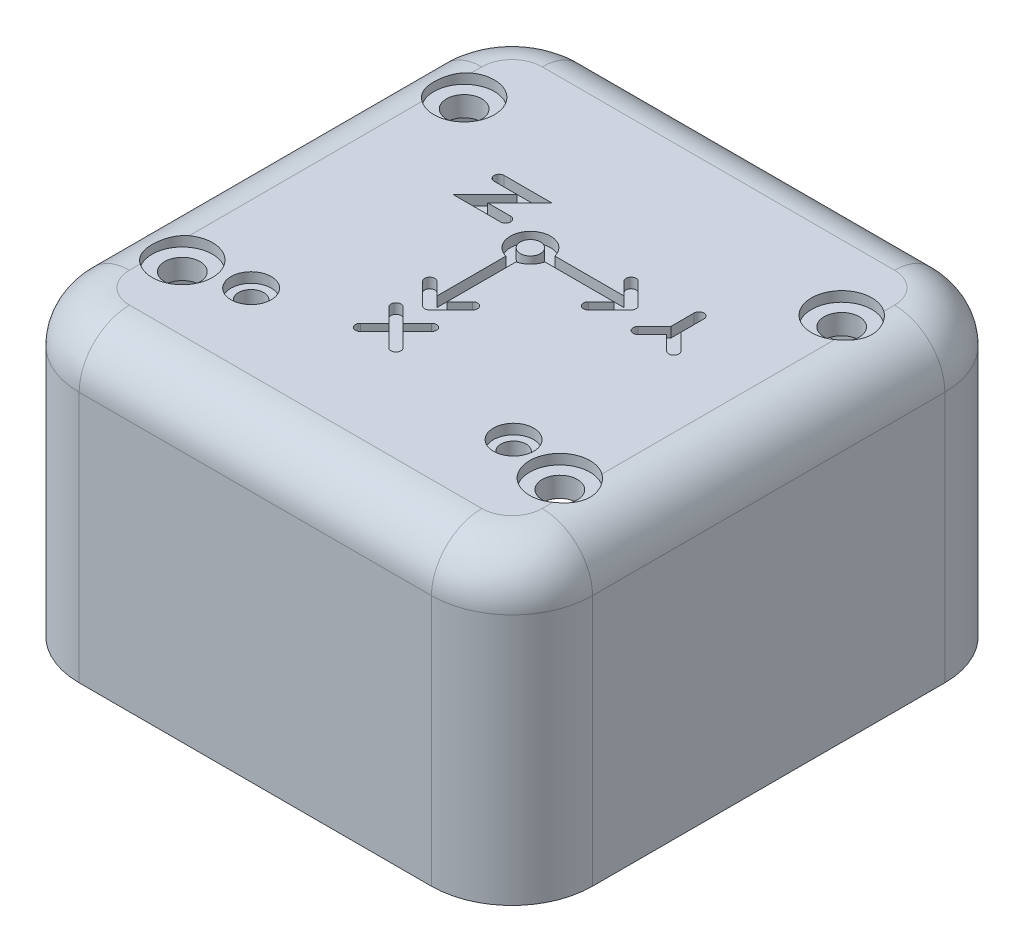
from build123d import *

# Parameters (mm, degrees)
BOSS_EXTRUDE1_DEPTH = 30
CUT_EXTRUDE1_DEPTH  = 27
SKETCH3_R           = 1.75
SKETCH3_R_2         = 1.25
CUT_EXTRUDE2_DEPTH  = 3
SKETCH4_R           = 3
SKETCH4_R_2         = 2
CUT_EXTRUDE3_DEPTH  = 1
CUT_EXTRUDE4_DEPTH  = 2
FILLET1_R           = 5
FILLET2_R           = 1.5
SKETCH6_R           = 1
CUT_EXTRUDE5_DEPTH  = 1
CUT_EXTRUDE6_DEPTH  = 0.8


with BuildPart() as part:
    # Sketch1 → Boss-Extrude1 (new body)
    with BuildSketch(Plane(origin=(0, 0, 0), x_dir=(1, 0, 0), z_dir=(0, 1, 0))):
        with BuildLine():
            Line((8, 0), (43, 0))
            ThreePointArc((43, 0), (48.656854249, 2.343145751), (51, 8))
            Line((51, 8), (51, 43))
            ThreePointArc((51, 43), (48.656854249, 48.656854249), (43, 51))
            Line((43, 51), (8, 51))
            ThreePointArc((8, 51), (2.343145751, 48.656854249), (0, 43))
            Line((0, 43), (0, 8))
            ThreePointArc((0, 8), (2.343145751, 2.343145751), (8, 0))
        make_face()
    extrude(amount=BOSS_EXTRUDE1_DEPTH)

    # Sketch2 → Cut-Extrude1 (cut)
    with BuildSketch(Plane.XZ):
        with BuildLine():
            Line((8, -2), (43, -2))
            ThreePointArc((43, -2), (47.242640687, -3.757359313), (49, -8))
            Line((49, -8), (49, -43))
            ThreePointArc((49, -43), (47.242640687, -47.242640687), (43, -49))
            Line((43, -49), (8, -49))
            ThreePointArc((8, -49), (3.757359313, -47.242640687), (2, -43))
            Line((2, -43), (2, -8))
            ThreePointArc((2, -8), (3.757359313, -3.757359313), (8, -2))
        make_face()
    extrude(amount=-CUT_EXTRUDE1_DEPTH, mode=Mode.SUBTRACT)

    # Sketch3 → Cut-Extrude2 (cut)
    with BuildSketch(Plane.XZ.offset(-27)):
        with Locations(Location((6.75, -11.5, 0), (0, 0, 270))):
            Circle(SKETCH3_R)
        with Locations(Location((44.25, -11.5, 0), (0, 0, 90))):
            Circle(SKETCH3_R)
        with Locations(Location((44.25, -39.5, 0), (0, 0, 270))):
            Circle(SKETCH3_R)
        with Locations(Location((6.75, -39.5, 0), (0, 0, 90))):
            Circle(SKETCH3_R)
        with Locations(Location((38.655, -12.5, 0), (0, 0, 270))):
            Circle(SKETCH3_R_2)
        with Locations(Location((12.585, -12.5, 0), (0, 0, 270))):
            Circle(SKETCH3_R_2)
    extrude(amount=-CUT_EXTRUDE2_DEPTH, mode=Mode.SUBTRACT)

    # Sketch4 → Cut-Extrude3 (cut)
    with BuildSketch(Plane(origin=(0, 30, 0), x_dir=(1, 0, 0), z_dir=(0, 1, 0))):
        with Locations(Location((44.25, 39.5, 0), (0, 0, 270))):
            Circle(SKETCH4_R)
        with Locations(Location((6.75, 39.5, 0), (0, 0, 270))):
            Circle(SKETCH4_R)
        with Locations(Location((6.75, 11.5, 0), (0, 0, 270))):
            Circle(SKETCH4_R)
        with Locations(Location((12.585, 12.5, 0), (0, 0, 270))):
            Circle(SKETCH4_R_2)
        with Locations(Location((38.655, 12.5, 0), (0, 0, 270))):
            Circle(SKETCH4_R_2)
        with Locations(Location((44.25, 11.5, 0), (0, 0, 270))):
            Circle(SKETCH4_R)
    extrude(amount=-CUT_EXTRUDE3_DEPTH, mode=Mode.SUBTRACT)

    # Sketch5 → Cut-Extrude4 (cut)
    with BuildSketch(Plane.XY.offset(-49)):
        with BuildLine():
            Line((9.585, 18), (34.085, 18))
            ThreePointArc((34.085, 18), (34.792106781, 17.707106781), (35.085, 17))
            Line((35.085, 17), (35.085, 14))
            ThreePointArc((35.085, 14), (34.792106781, 13.292893219), (34.085, 13))
            Line((34.085, 13), (9.585, 13))
            ThreePointArc((9.585, 13), (8.877893219, 13.292893219), (8.585, 14))
            Line((8.585, 14), (8.585, 17))
            ThreePointArc((8.585, 17), (8.877893219, 17.707106781), (9.585, 18))
        make_face()
    extrude(amount=-CUT_EXTRUDE4_DEPTH, mode=Mode.SUBTRACT)

    # Fillet1
    # the kernel refuses this fillet: 5 mm, written as the material it takes off along each edge
    with BuildSketch(Plane(origin=(8, 30, -43), x_dir=(0, 0, -1), z_dir=(1, 0, 0))) as fillet1_piece_1:
        with BuildLine():
            CenterArc((8 - FILLET1_R, -FILLET1_R), FILLET1_R, 0, 90)
            Line((8 - FILLET1_R, 0), (8, 0))
            Line((8, 0), (8, -FILLET1_R))
        make_face()
    revolve(axis=Axis((8, 30, -43), (0, 1, 0)), revolution_arc=90, mode=Mode.SUBTRACT)
    with BuildSketch(Plane(origin=(0, 30, -43), x_dir=(0, -1, 0), z_dir=(0, 0, 1))) as fillet1_piece_2:
        with BuildLine():
            CenterArc((FILLET1_R, FILLET1_R), FILLET1_R, 180, 90)
            Line((0, FILLET1_R), (0, 0))
            Line((0, 0), (FILLET1_R, 0))
        make_face()
    extrude(amount=35, mode=Mode.SUBTRACT)
    with BuildSketch(Plane(origin=(8, 30, -8), x_dir=(-1, 0, 0), z_dir=(0, 0, -1))) as fillet1_piece_3:
        with BuildLine():
            CenterArc((8 - FILLET1_R, -FILLET1_R), FILLET1_R, 0, 90)
            Line((8 - FILLET1_R, 0), (8, 0))
            Line((8, 0), (8, -FILLET1_R))
        make_face()
    revolve(axis=Axis((8, 30, -8), (0, 1, 0)), revolution_arc=90, mode=Mode.SUBTRACT)
    with BuildSketch(Plane(origin=(8, 30, 0), x_dir=(0, 0, -1), z_dir=(1, 0, 0)), Plane(origin=(51, 30, -8), x_dir=(-1, 0, 0), z_dir=(0, 0, -1)), Plane(origin=(43, 30, -51), x_dir=(0, 0, 1), z_dir=(-1, 0, 0))) as fillet1_piece_4:
        with BuildLine():
            CenterArc((FILLET1_R, -FILLET1_R), FILLET1_R, 90, 90)
            Line((0, -FILLET1_R), (0, 0))
            Line((0, 0), (FILLET1_R, 0))
        make_face()
    extrude(amount=35, mode=Mode.SUBTRACT)
    with BuildSketch(Plane(origin=(43, 30, -8), x_dir=(0, 0, 1), z_dir=(-1, 0, 0))) as fillet1_piece_5:
        with BuildLine():
            CenterArc((8 - FILLET1_R, -FILLET1_R), FILLET1_R, 0, 90)
            Line((8, -FILLET1_R), (8, 0))
            Line((8, 0), (8 - FILLET1_R, 0))
        make_face()
    revolve(axis=Axis((43, 30, -8), (0, 1, 0)), revolution_arc=90, mode=Mode.SUBTRACT)
    with BuildSketch(Plane(origin=(43, 30, -43), x_dir=(1, 0, 0), z_dir=(0, 0, 1))) as fillet1_piece_6:
        with BuildLine():
            CenterArc((8 - FILLET1_R, -FILLET1_R), FILLET1_R, 0, 90)
            Line((8, -FILLET1_R), (8, 0))
            Line((8, 0), (8 - FILLET1_R, 0))
        make_face()
    revolve(axis=Axis((43, 30, -43), (0, 1, 0)), revolution_arc=90, mode=Mode.SUBTRACT)

    # Fillet2
    fillet2_edges = [part.edges().sort_by_distance(p)[0] for p in [
        (47.242640687, 27, -47.242640687),
        (25.5, 27, -49),
        (3.757359313, 27, -47.242640687),
        (2, 27, -25.5),
        (3.757359313, 27, -3.757359313),
        (25.5, 27, -2),
        (47.242640687, 27, -3.757359313),
        (49, 27, -25.5),
    ]]
    fillet(fillet2_edges, radius=FILLET2_R)

    # Sketch6 → Cut-Extrude5 (cut)
    # profile 1 of 4: a face of its own
    with BuildSketch(Plane(origin=(0, 30, 0), x_dir=(1, 0, 0), z_dir=(0, 1, 0))):
        with BuildLine():
            Line((24.920410097, 30.348440054), (31.776811643, 30.348440054))
            Line((31.776811643, 30.348440054), (30.50904469, 31.616207007))
            ThreePointArc((30.50904469, 31.616207007), (30.50904469, 32.323313788), (31.216151471, 32.323313788))
            Line((31.216151471, 32.323313788), (33.337471815, 30.201993444))
            ThreePointArc((33.337471815, 30.201993444), (33.483918424, 29.848440054), (33.337471815, 29.494886663))
            Line((33.337471815, 29.494886663), (31.216151471, 27.37356632))
            ThreePointArc((31.216151471, 27.37356632), (30.50904469, 27.37356632), (30.50904469, 28.080673101))
            Line((30.50904469, 28.080673101), (31.776811643, 29.348440054))
            Line((31.776811643, 29.348440054), (24.920410097, 29.348440054))
            ThreePointArc((24.920410097, 29.348440054), (24.398131986, 28.434226491), (23.483918424, 27.911948381))
            Line((23.483918424, 27.911948381), (23.483918424, 21.055546835))
            Line((23.483918424, 21.055546835), (24.751685377, 22.323313788))
            ThreePointArc((24.751685377, 22.323313788), (25.458792158, 22.323313788), (25.458792158, 21.616207007))
            Line((25.458792158, 21.616207007), (23.337471815, 19.494886663))
            ThreePointArc((23.337471815, 19.494886663), (22.983918424, 19.348440054), (22.630365033, 19.494886663))
            Line((22.630365033, 19.494886663), (20.50904469, 21.616207007))
            ThreePointArc((20.50904469, 21.616207007), (20.50904469, 22.323313788), (21.216151471, 22.323313788))
            Line((21.216151471, 22.323313788), (22.483918424, 21.055546835))
            Line((22.483918424, 21.055546835), (22.483918424, 27.911948381))
            ThreePointArc((22.483918424, 27.911948381), (21.569704862, 31.262653616), (24.920410097, 30.348440054))
        make_face()
        with Locations(Location((22.983918424, 29.848440054, 0), (0, 0, 270))):
            Circle(SKETCH6_R, mode=Mode.SUBTRACT)
    # profile 2 of 4: a face of its own
    with BuildSketch(Plane(origin=(0, 30, 0), x_dir=(1, 0, 0), z_dir=(0, 1, 0))):
        with BuildLine():
            Line((20.166103424, 34.766202804), (15.455317355, 34.766202804))
            ThreePointArc((15.455317355, 34.766202804), (14.955317355, 34.266202804), (15.455317355, 33.766202804))
            Line((15.455317355, 33.766202804), (17.751889862, 33.766202804))
            Line((17.751889862, 33.766202804), (14.569909347, 30.584222289))
            Line((14.569909347, 30.584222289), (19.277016128, 30.584222289))
            ThreePointArc((19.277016128, 30.584222289), (19.777016128, 31.084222289), (19.277016128, 31.584222289))
            Line((19.277016128, 31.584222289), (16.984122909, 31.584222289))
            Line((16.984122909, 31.584222289), (20.166103424, 34.766202804))
        make_face()
    # profile 3 of 4: a face of its own
    with BuildSketch(Plane(origin=(0, 30, 0), x_dir=(1, 0, 0), z_dir=(0, 1, 0))):
        with BuildLine():
            Line((37.725215013, 30.056361033), (37.725215013, 32.349254251))
            ThreePointArc((37.725215013, 32.349254251), (37.225215013, 32.849254251), (36.725215013, 32.349254251))
            Line((36.725215013, 32.349254251), (36.725215013, 30.056361033))
            Line((36.725215013, 30.056361033), (35.103894669, 28.435040689))
            ThreePointArc((35.103894669, 28.435040689), (35.103894669, 27.727933908), (35.81100145, 27.727933908))
            Line((35.81100145, 27.727933908), (37.225215013, 29.14214747))
            Line((37.225215013, 29.14214747), (38.639428575, 27.727933908))
            ThreePointArc((38.639428575, 27.727933908), (39.346535356, 27.727933908), (39.346535356, 28.435040689))
            Line((39.346535356, 28.435040689), (37.725215013, 30.056361033))
        make_face()
    # profile 4 of 4: a face of its own
    with BuildSketch(Plane(origin=(0, 30, 0), x_dir=(1, 0, 0), z_dir=(0, 1, 0))):
        with BuildLine():
            Line((23.864017642, 16.318192841), (25.278231204, 17.732406403))
            ThreePointArc((25.278231204, 17.732406403), (25.278231204, 18.439513185), (24.571124423, 18.439513185))
            Line((24.571124423, 18.439513185), (23.15691086, 17.025299622))
            Line((23.15691086, 17.025299622), (21.742697298, 18.439513185))
            ThreePointArc((21.742697298, 18.439513185), (21.035590517, 18.439513185), (21.035590517, 17.732406403))
            Line((21.035590517, 17.732406403), (22.449804079, 16.318192841))
            Line((22.449804079, 16.318192841), (21.035590517, 14.903979279))
            ThreePointArc((21.035590517, 14.903979279), (21.035590517, 14.196872497), (21.742697298, 14.196872497))
            Line((21.742697298, 14.196872497), (23.15691086, 15.61108606))
            Line((23.15691086, 15.61108606), (24.571124423, 14.196872497))
            ThreePointArc((24.571124423, 14.196872497), (25.278231204, 14.196872497), (25.278231204, 14.903979279))
            Line((25.278231204, 14.903979279), (23.864017642, 16.318192841))
        make_face()
    extrude(amount=-CUT_EXTRUDE5_DEPTH, mode=Mode.SUBTRACT)

    # Sketch7 → Cut-Extrude6 (cut)
    with BuildSketch(Plane(origin=(0, 0, -51), x_dir=(-1, 0, 0), z_dir=(0, 0, -1))):
        with BuildLine():
            Line((-35.085, 23), (-8.585, 23))
            ThreePointArc((-8.585, 23), (-5.049466094, 21.535533906), (-3.585, 18))
            Line((-3.585, 18), (-3.585, 13))
            ThreePointArc((-3.585, 13), (-5.049466094, 9.464466094), (-8.585, 8))
            Line((-8.585, 8), (-35.085, 8))
            ThreePointArc((-35.085, 8), (-38.620533906, 9.464466094), (-40.085, 13))
            Line((-40.085, 13), (-40.085, 18))
            ThreePointArc((-40.085, 18), (-38.620533906, 21.535533906), (-35.085, 23))
        make_face()
    extrude(amount=-CUT_EXTRUDE6_DEPTH, mode=Mode.SUBTRACT)


solid = part.part
